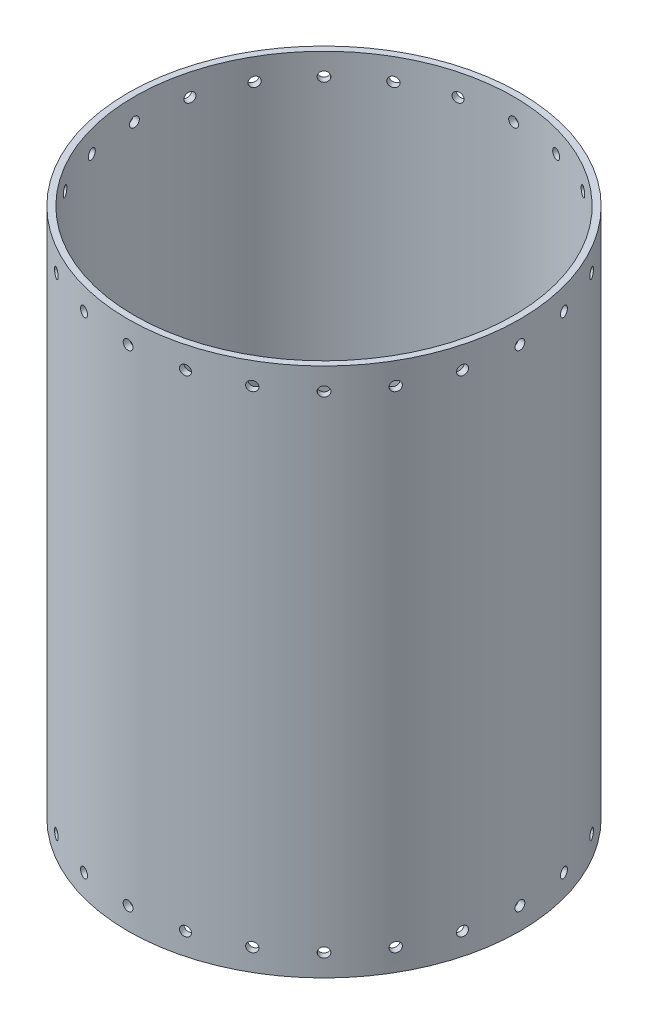
from build123d import *

# Parameters (mm, degrees)
SKETCH1_R                = 101.727
SKETCH1_R_2              = 98.425
EXTRUDE_THIN1_DEPTH      = 275.082
SKETCH2_W                = 2.54
SKETCH2_H                = 12.7
CIRPATTERN1_COUNT        = 24
MIRROR1_COPY_1_SKETCH_W  = 2.54
MIRROR1_COPY_1_SKETCH_H  = 12.7
MIRROR1_COPY_2_SKETCH_W  = 2.54
MIRROR1_COPY_2_SKETCH_H  = 12.7
MIRROR1_COPY_3_SKETCH_W  = 2.54
MIRROR1_COPY_3_SKETCH_H  = 12.7
MIRROR1_COPY_4_SKETCH_W  = 2.54
MIRROR1_COPY_4_SKETCH_H  = 12.7
MIRROR1_COPY_5_SKETCH_W  = 2.54
MIRROR1_COPY_5_SKETCH_H  = 12.7
MIRROR1_COPY_6_SKETCH_W  = 2.54
MIRROR1_COPY_6_SKETCH_H  = 12.7
MIRROR1_COPY_7_SKETCH_W  = 2.54
MIRROR1_COPY_7_SKETCH_H  = 12.7
MIRROR1_COPY_8_SKETCH_W  = 2.54
MIRROR1_COPY_8_SKETCH_H  = 12.7
MIRROR1_COPY_9_SKETCH_W  = 2.54
MIRROR1_COPY_9_SKETCH_H  = 12.7
MIRROR1_COPY_10_SKETCH_W = 2.54
MIRROR1_COPY_10_SKETCH_H = 12.7
MIRROR1_COPY_11_SKETCH_W = 2.54
MIRROR1_COPY_11_SKETCH_H = 12.7
MIRROR1_COPY_12_SKETCH_W = 2.54
MIRROR1_COPY_12_SKETCH_H = 12.7
MIRROR1_COPY_13_SKETCH_W = 2.54
MIRROR1_COPY_13_SKETCH_H = 12.7
MIRROR1_COPY_14_SKETCH_W = 2.54
MIRROR1_COPY_14_SKETCH_H = 12.7
MIRROR1_COPY_15_SKETCH_W = 2.54
MIRROR1_COPY_15_SKETCH_H = 12.7
MIRROR1_COPY_16_SKETCH_W = 2.54
MIRROR1_COPY_16_SKETCH_H = 12.7
MIRROR1_COPY_17_SKETCH_W = 2.54
MIRROR1_COPY_17_SKETCH_H = 12.7
MIRROR1_COPY_18_SKETCH_W = 2.54
MIRROR1_COPY_18_SKETCH_H = 12.7
MIRROR1_COPY_19_SKETCH_W = 2.54
MIRROR1_COPY_19_SKETCH_H = 12.7
MIRROR1_COPY_20_SKETCH_W = 2.54
MIRROR1_COPY_20_SKETCH_H = 12.7
MIRROR1_COPY_21_SKETCH_W = 2.54
MIRROR1_COPY_21_SKETCH_H = 12.7
MIRROR1_COPY_22_SKETCH_W = 2.54
MIRROR1_COPY_22_SKETCH_H = 12.7
MIRROR1_COPY_23_SKETCH_W = 2.54
MIRROR1_COPY_23_SKETCH_H = 12.7
MIRROR1_COPY_24_SKETCH_W = 2.54
MIRROR1_COPY_24_SKETCH_H = 12.7


with BuildPart() as part:
    # Sketch1 → Extrude-Thin1 (new body)
    with BuildSketch(Plane(origin=(0, 0, 0), x_dir=(1, 0, 0), z_dir=(0, 1, 0))):
        Circle(SKETCH1_R)
        Circle(SKETCH1_R_2, mode=Mode.SUBTRACT)
    extrude(amount=EXTRUDE_THIN1_DEPTH)

    # Sketch2 → Cut-Revolve1 (revolve, cut)
    with BuildSketch(Plane(origin=(0, 263.652, 0), x_dir=(1, 0, 0), z_dir=(0, 1, 0))):
        with Locations((1.27, -100.33)):
            Rectangle(SKETCH2_W, SKETCH2_H)
    cut_revolve1 = revolve(axis=Axis((0, 263.652, 0), (0, 0, 1)), mode=Mode.SUBTRACT)

    # CirPattern1: Cut-Revolve1 ×24 about axis
    cirpattern1_axis = Axis((0, 0, 0), (0, 1, 0))
    for i in range(1, CIRPATTERN1_COUNT):
        add(cut_revolve1.rotate(cirpattern1_axis, i * 360 / CIRPATTERN1_COUNT), mode=Mode.SUBTRACT)

    # Mirror1 copy 1 sketch → Mirror1 copy 1 (revolve, cut)
    with BuildSketch(Plane(origin=(0, 11.43, 0), x_dir=(0.9659258262890683, 0, -0.25881904510252074), z_dir=(0, -1, 0))):
        with Locations((1.27, 100.33)):
            Rectangle(MIRROR1_COPY_1_SKETCH_W, MIRROR1_COPY_1_SKETCH_H)
    revolve(axis=Axis((0, 11.43, 0), (-0.25881904510252074, 0, -0.9659258262890683)), mode=Mode.SUBTRACT)

    # Mirror1 copy 2 sketch → Mirror1 copy 2 (revolve, cut)
    with BuildSketch(Plane(origin=(0, 11.43, 0), x_dir=(0.8660254037844387, 0, -0.49999999999999994), z_dir=(0, -1, 0))):
        with Locations((1.27, 100.33)):
            Rectangle(MIRROR1_COPY_2_SKETCH_W, MIRROR1_COPY_2_SKETCH_H)
    revolve(axis=Axis((0, 11.43, 0), (-0.49999999999999994, 0, -0.8660254037844387)), mode=Mode.SUBTRACT)

    # Mirror1 copy 3 sketch → Mirror1 copy 3 (revolve, cut)
    with BuildSketch(Plane(origin=(0, 11.43, 0), x_dir=(0.7071067811865476, 0, -0.7071067811865475), z_dir=(0, -1, 0))):
        with Locations((1.27, 100.33)):
            Rectangle(MIRROR1_COPY_3_SKETCH_W, MIRROR1_COPY_3_SKETCH_H)
    revolve(axis=Axis((0, 11.43, 0), (-0.7071067811865475, 0, -0.7071067811865476)), mode=Mode.SUBTRACT)

    # Mirror1 copy 4 sketch → Mirror1 copy 4 (revolve, cut)
    with BuildSketch(Plane(origin=(0, 11.43, 0), x_dir=(0.5000000000000001, 0, -0.8660254037844386), z_dir=(0, -1, 0))):
        with Locations((1.27, 100.33)):
            Rectangle(MIRROR1_COPY_4_SKETCH_W, MIRROR1_COPY_4_SKETCH_H)
    revolve(axis=Axis((0, 11.43, 0), (-0.8660254037844386, 0, -0.5000000000000001)), mode=Mode.SUBTRACT)

    # Mirror1 copy 5 sketch → Mirror1 copy 5 (revolve, cut)
    with BuildSketch(Plane(origin=(0, 11.43, 0), x_dir=(0.25881904510252074, 0, -0.9659258262890683), z_dir=(0, -1, 0))):
        with Locations((1.27, 100.33)):
            Rectangle(MIRROR1_COPY_5_SKETCH_W, MIRROR1_COPY_5_SKETCH_H)
    revolve(axis=Axis((0, 11.43, 0), (-0.9659258262890683, 0, -0.25881904510252074)), mode=Mode.SUBTRACT)

    # Mirror1 copy 6 sketch → Mirror1 copy 6 (revolve, cut)
    with BuildSketch(Plane(origin=(0, 11.43, 0), x_dir=(0, 0, -1), z_dir=(0, -1, 0))):
        with Locations((1.27, 100.33)):
            Rectangle(MIRROR1_COPY_6_SKETCH_W, MIRROR1_COPY_6_SKETCH_H)
    revolve(axis=Axis((0, 11.43, 0), (-1, 0, 0)), mode=Mode.SUBTRACT)

    # Mirror1 copy 7 sketch → Mirror1 copy 7 (revolve, cut)
    with BuildSketch(Plane(origin=(0, 11.43, 0), x_dir=(-0.25881904510252085, 0, -0.9659258262890683), z_dir=(0, -1, 0))):
        with Locations((1.27, 100.33)):
            Rectangle(MIRROR1_COPY_7_SKETCH_W, MIRROR1_COPY_7_SKETCH_H)
    revolve(axis=Axis((0, 11.43, 0), (-0.9659258262890683, 0, 0.25881904510252085)), mode=Mode.SUBTRACT)

    # Mirror1 copy 8 sketch → Mirror1 copy 8 (revolve, cut)
    with BuildSketch(Plane(origin=(0, 11.43, 0), x_dir=(-0.4999999999999998, 0, -0.8660254037844387), z_dir=(0, -1, 0))):
        with Locations((1.27, 100.33)):
            Rectangle(MIRROR1_COPY_8_SKETCH_W, MIRROR1_COPY_8_SKETCH_H)
    revolve(axis=Axis((0, 11.43, 0), (-0.8660254037844387, 0, 0.4999999999999998)), mode=Mode.SUBTRACT)

    # Mirror1 copy 9 sketch → Mirror1 copy 9 (revolve, cut)
    with BuildSketch(Plane(origin=(0, 11.43, 0), x_dir=(-0.7071067811865475, 0, -0.7071067811865476), z_dir=(0, -1, 0))):
        with Locations((1.27, 100.33)):
            Rectangle(MIRROR1_COPY_9_SKETCH_W, MIRROR1_COPY_9_SKETCH_H)
    revolve(axis=Axis((0, 11.43, 0), (-0.7071067811865476, 0, 0.7071067811865475)), mode=Mode.SUBTRACT)

    # Mirror1 copy 10 sketch → Mirror1 copy 10 (revolve, cut)
    with BuildSketch(Plane(origin=(0, 11.43, 0), x_dir=(-0.8660254037844387, 0, -0.49999999999999994), z_dir=(0, -1, 0))):
        with Locations((1.27, 100.33)):
            Rectangle(MIRROR1_COPY_10_SKETCH_W, MIRROR1_COPY_10_SKETCH_H)
    revolve(axis=Axis((0, 11.43, 0), (-0.49999999999999994, 0, 0.8660254037844387)), mode=Mode.SUBTRACT)

    # Mirror1 copy 11 sketch → Mirror1 copy 11 (revolve, cut)
    with BuildSketch(Plane(origin=(0, 11.43, 0), x_dir=(-0.9659258262890682, 0, -0.258819045102521), z_dir=(0, -1, 0))):
        with Locations((1.27, 100.33)):
            Rectangle(MIRROR1_COPY_11_SKETCH_W, MIRROR1_COPY_11_SKETCH_H)
    revolve(axis=Axis((0, 11.43, 0), (-0.258819045102521, 0, 0.9659258262890682)), mode=Mode.SUBTRACT)

    # Mirror1 copy 12 sketch → Mirror1 copy 12 (revolve, cut)
    with BuildSketch(Plane(origin=(0, 11.43, 0), x_dir=(-1, 0, 0), z_dir=(0, -1, 0))):
        with Locations((1.27, 100.33)):
            Rectangle(MIRROR1_COPY_12_SKETCH_W, MIRROR1_COPY_12_SKETCH_H)
    revolve(axis=Axis((0, 11.43, 0), (0, 0, 1)), mode=Mode.SUBTRACT)

    # Mirror1 copy 13 sketch → Mirror1 copy 13 (revolve, cut)
    with BuildSketch(Plane(origin=(0, 11.43, 0), x_dir=(-0.9659258262890683, 0, 0.2588190451025208), z_dir=(0, -1, 0))):
        with Locations((1.27, 100.33)):
            Rectangle(MIRROR1_COPY_13_SKETCH_W, MIRROR1_COPY_13_SKETCH_H)
    revolve(axis=Axis((0, 11.43, 0), (0.2588190451025208, 0, 0.9659258262890683)), mode=Mode.SUBTRACT)

    # Mirror1 copy 14 sketch → Mirror1 copy 14 (revolve, cut)
    with BuildSketch(Plane(origin=(0, 11.43, 0), x_dir=(-0.8660254037844386, 0, 0.5000000000000001), z_dir=(0, -1, 0))):
        with Locations((1.27, 100.33)):
            Rectangle(MIRROR1_COPY_14_SKETCH_W, MIRROR1_COPY_14_SKETCH_H)
    revolve(axis=Axis((0, 11.43, 0), (0.5000000000000001, 0, 0.8660254037844386)), mode=Mode.SUBTRACT)

    # Mirror1 copy 15 sketch → Mirror1 copy 15 (revolve, cut)
    with BuildSketch(Plane(origin=(0, 11.43, 0), x_dir=(-0.7071067811865477, 0, 0.7071067811865475), z_dir=(0, -1, 0))):
        with Locations((1.27, 100.33)):
            Rectangle(MIRROR1_COPY_15_SKETCH_W, MIRROR1_COPY_15_SKETCH_H)
    revolve(axis=Axis((0, 11.43, 0), (0.7071067811865475, 0, 0.7071067811865477)), mode=Mode.SUBTRACT)

    # Mirror1 copy 16 sketch → Mirror1 copy 16 (revolve, cut)
    with BuildSketch(Plane(origin=(0, 11.43, 0), x_dir=(-0.5000000000000004, 0, 0.8660254037844384), z_dir=(0, -1, 0))):
        with Locations((1.27, 100.33)):
            Rectangle(MIRROR1_COPY_16_SKETCH_W, MIRROR1_COPY_16_SKETCH_H)
    revolve(axis=Axis((0, 11.43, 0), (0.8660254037844384, 0, 0.5000000000000004)), mode=Mode.SUBTRACT)

    # Mirror1 copy 17 sketch → Mirror1 copy 17 (revolve, cut)
    with BuildSketch(Plane(origin=(0, 11.43, 0), x_dir=(-0.25881904510252063, 0, 0.9659258262890683), z_dir=(0, -1, 0))):
        with Locations((1.27, 100.33)):
            Rectangle(MIRROR1_COPY_17_SKETCH_W, MIRROR1_COPY_17_SKETCH_H)
    revolve(axis=Axis((0, 11.43, 0), (0.9659258262890683, 0, 0.25881904510252063)), mode=Mode.SUBTRACT)

    # Mirror1 copy 18 sketch → Mirror1 copy 18 (revolve, cut)
    with BuildSketch(Plane(origin=(0, 11.43, 0), x_dir=(0, 0, 1), z_dir=(0, -1, 0))):
        with Locations((1.27, 100.33)):
            Rectangle(MIRROR1_COPY_18_SKETCH_W, MIRROR1_COPY_18_SKETCH_H)
    revolve(axis=Axis((0, 11.43, 0), (1, 0, 0)), mode=Mode.SUBTRACT)

    # Mirror1 copy 19 sketch → Mirror1 copy 19 (revolve, cut)
    with BuildSketch(Plane(origin=(0, 11.43, 0), x_dir=(0.2588190451025203, 0, 0.9659258262890684), z_dir=(0, -1, 0))):
        with Locations((1.27, 100.33)):
            Rectangle(MIRROR1_COPY_19_SKETCH_W, MIRROR1_COPY_19_SKETCH_H)
    revolve(axis=Axis((0, 11.43, 0), (0.9659258262890684, 0, -0.2588190451025203)), mode=Mode.SUBTRACT)

    # Mirror1 copy 20 sketch → Mirror1 copy 20 (revolve, cut)
    with BuildSketch(Plane(origin=(0, 11.43, 0), x_dir=(0.5000000000000001, 0, 0.8660254037844386), z_dir=(0, -1, 0))):
        with Locations((1.27, 100.33)):
            Rectangle(MIRROR1_COPY_20_SKETCH_W, MIRROR1_COPY_20_SKETCH_H)
    revolve(axis=Axis((0, 11.43, 0), (0.8660254037844386, 0, -0.5000000000000001)), mode=Mode.SUBTRACT)

    # Mirror1 copy 21 sketch → Mirror1 copy 21 (revolve, cut)
    with BuildSketch(Plane(origin=(0, 11.43, 0), x_dir=(0.7071067811865474, 0, 0.7071067811865477), z_dir=(0, -1, 0))):
        with Locations((1.27, 100.33)):
            Rectangle(MIRROR1_COPY_21_SKETCH_W, MIRROR1_COPY_21_SKETCH_H)
    revolve(axis=Axis((0, 11.43, 0), (0.7071067811865477, 0, -0.7071067811865474)), mode=Mode.SUBTRACT)

    # Mirror1 copy 22 sketch → Mirror1 copy 22 (revolve, cut)
    with BuildSketch(Plane(origin=(0, 11.43, 0), x_dir=(0.8660254037844384, 0, 0.5000000000000004), z_dir=(0, -1, 0))):
        with Locations((1.27, 100.33)):
            Rectangle(MIRROR1_COPY_22_SKETCH_W, MIRROR1_COPY_22_SKETCH_H)
    revolve(axis=Axis((0, 11.43, 0), (0.5000000000000004, 0, -0.8660254037844384)), mode=Mode.SUBTRACT)

    # Mirror1 copy 23 sketch → Mirror1 copy 23 (revolve, cut)
    with BuildSketch(Plane(origin=(0, 11.43, 0), x_dir=(0.9659258262890683, 0, 0.2588190451025207), z_dir=(0, -1, 0))):
        with Locations((1.27, 100.33)):
            Rectangle(MIRROR1_COPY_23_SKETCH_W, MIRROR1_COPY_23_SKETCH_H)
    revolve(axis=Axis((0, 11.43, 0), (0.2588190451025207, 0, -0.9659258262890683)), mode=Mode.SUBTRACT)

    # Mirror1 copy 24 sketch → Mirror1 copy 24 (revolve, cut)
    with BuildSketch(Plane.XZ.offset(-11.43)):
        with Locations((1.27, 100.33)):
            Rectangle(MIRROR1_COPY_24_SKETCH_W, MIRROR1_COPY_24_SKETCH_H)
    revolve(axis=Axis((0, 11.43, 0), (0, 0, -1)), mode=Mode.SUBTRACT)


solid = part.part
